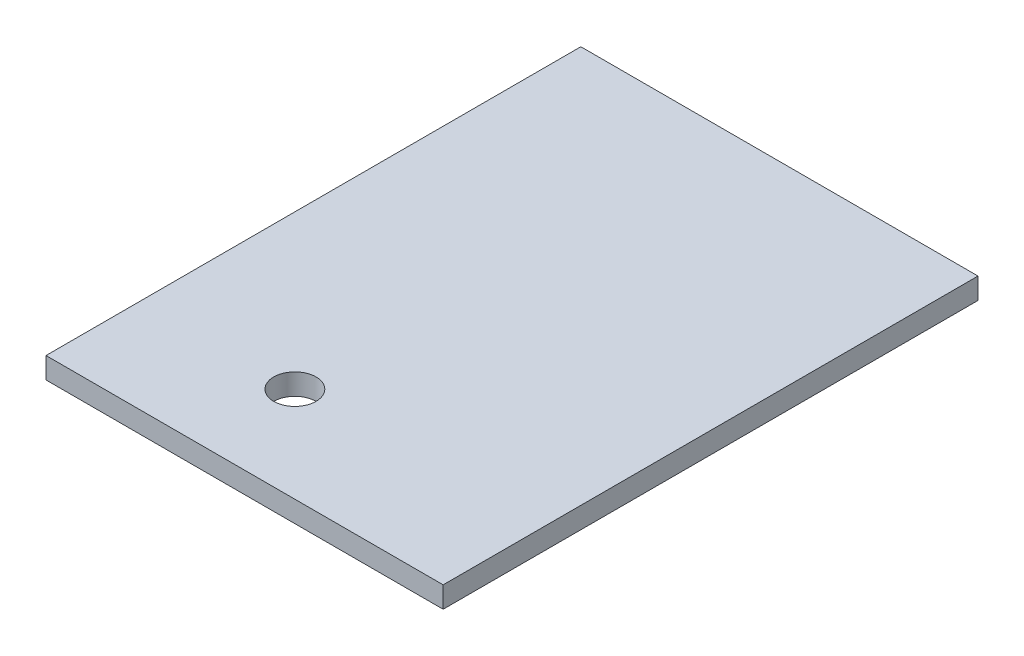
from build123d import *

# Parameters (mm, degrees)
SKETCH1_W           = 37.5
SKETCH1_H           = 50.5
BOSS_EXTRUDE1_DEPTH = 2
SKETCH2_R           = 2
CUT_EXTRUDE1_DEPTH  = 32.513885828


with BuildPart() as part:
    # Sketch1 → Boss-Extrude1 (new body)
    with BuildSketch(Plane(origin=(0, 0, 0), x_dir=(1, 0, 0), z_dir=(0, 1, 0))):
        Rectangle(SKETCH1_W, SKETCH1_H)
    extrude(amount=BOSS_EXTRUDE1_DEPTH)

    # Sketch2 → Cut-Extrude1 (cut, through all)
    with BuildSketch(Plane(origin=(0, 2, 0), x_dir=(1, 0, 0), z_dir=(0, 1, 0))):
        with Locations((-4.25, -16.25)):
            Circle(SKETCH2_R)
    extrude(amount=-CUT_EXTRUDE1_DEPTH, mode=Mode.SUBTRACT)


solid = part.part
